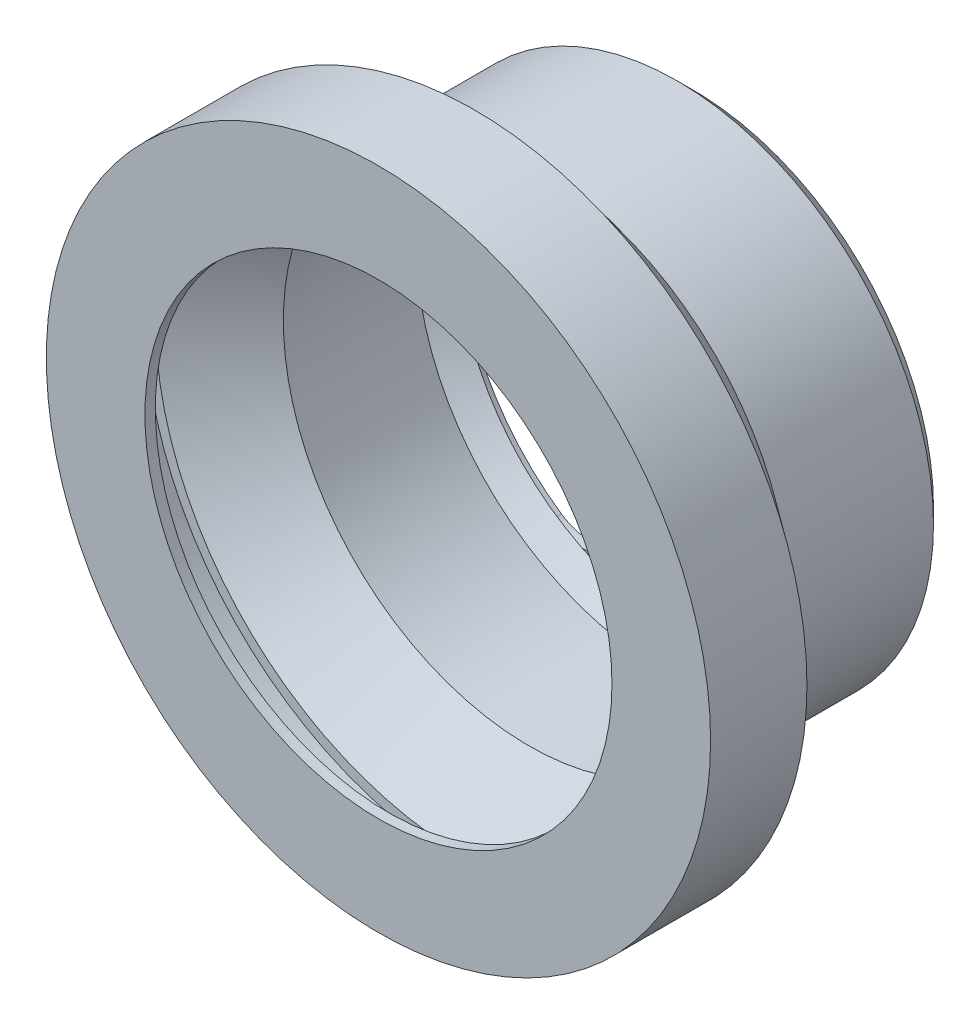
from build123d import *

# Parameters (mm, degrees)
BOSS_EXTRUDE2_START = 2
SKETCH3_R           = 49.35
SKETCH3_R_2         = 1.5
BOSS_EXTRUDE2_DEPTH = 2
FILLET1_R           = 10
FILLET2_R           = 10
CHAMFER1_SIZE       = 3
SKETCH6_W           = 130.40409261
SKETCH6_H           = 9
CUT_EXTRUDE1_DEPTH  = 72
SKETCH7_R           = 64
SKETCH7_R_2         = 45
BOSS_EXTRUDE3_DEPTH = 2


with BuildPart() as part:
    # Sketch2 → Revolve1 (revolve)
    with BuildSketch(Plane(origin=(0, 0, 0), x_dir=(0, 0, -1), z_dir=(1, 0, 0)), mode=Mode.PRIVATE) as revolve1_sk:
        Polygon((65.6, 47.35), (37, 47.35), (36.023809561, 47.35), (24, 60), (24, 62), (0, 62), (0, 64), (25.567979838, 64), (37, 49.35), (65.6, 49.35), align=None)
    revolve(revolve1_sk.sketch.rotate(Axis((0, 0, 1), (0, 0, -1)), 90), axis=Axis((0, 0, 1), (0, 0, -1)))

    # Sketch3 → Boss-Extrude2 (add)
    with BuildSketch(Plane(origin=(0, 0, -65.6), x_dir=(-1, 0, 0), z_dir=(0, 0, -1)).offset(BOSS_EXTRUDE2_START)):
        with Locations(Location((0, 0, 0), (0, 0, 180))):
            Circle(SKETCH3_R)
        with Locations((-14.646406867, -3.237709975)):
            Circle(SKETCH3_R_2, mode=Mode.SUBTRACT)
        with Locations((-3.237709975, 14.646406867)):
            Circle(SKETCH3_R_2, mode=Mode.SUBTRACT)
        with Locations((3.237709975, -14.646406867)):
            Circle(SKETCH3_R_2, mode=Mode.SUBTRACT)
        with Locations((14.646406867, 3.237709975)):
            Circle(SKETCH3_R_2, mode=Mode.SUBTRACT)
        with BuildLine():
            Line((2.426668662, -24.876217196), (6.743615296, -44.404759685))
            ThreePointArc((6.743615296, -44.404759685), (-24.155488069, -37.865174318), (-43.109904177, -12.601527718))
            Line((-43.109904177, -12.601527718), (-23.581361687, -8.284581085))
            ThreePointArc((-23.581361687, -8.284581085), (-13.442501867, -21.071640807), (2.426668662, -24.876217196))
        make_face(mode=Mode.SUBTRACT)
        with BuildLine():
            Line((-24.876217196, -2.426668662), (-44.404759685, -6.743615296))
            ThreePointArc((-44.404759685, -6.743615296), (-37.865174318, 24.155488069), (-12.601527718, 43.109904177))
            Line((-12.601527718, 43.109904177), (-8.284581085, 23.581361687))
            ThreePointArc((-8.284581085, 23.581361687), (-21.071640807, 13.442501867), (-24.876217196, -2.426668662))
        make_face(mode=Mode.SUBTRACT)
        with BuildLine():
            Line((-2.426668662, 24.876217196), (-6.743615296, 44.404759685))
            ThreePointArc((-6.743615296, 44.404759685), (24.155488069, 37.865174318), (43.109904177, 12.601527718))
            Line((43.109904177, 12.601527718), (23.581361687, 8.284581085))
            ThreePointArc((23.581361687, 8.284581085), (13.442501867, 21.071640807), (-2.426668662, 24.876217196))
        make_face(mode=Mode.SUBTRACT)
        with BuildLine():
            Line((8.284581085, -23.581361687), (12.601527718, -43.109904177))
            ThreePointArc((12.601527718, -43.109904177), (37.865174318, -24.155488069), (44.404759685, 6.743615296))
            Line((44.404759685, 6.743615296), (24.876217196, 2.426668662))
            ThreePointArc((24.876217196, 2.426668662), (21.071640807, -13.442501867), (8.284581085, -23.581361687))
        make_face(mode=Mode.SUBTRACT)
    extrude(amount=-BOSS_EXTRUDE2_DEPTH)

    # Fillet1
    # the kernel refuses this fillet: 10 mm, written as the material it adds along each edge
    with BuildSketch(Plane(origin=(-12.601527718, -43.109904177, -67.6), x_dir=(-0.9040126559830293, 0.4275056933217488, 0), z_dir=(0, 0, 1))) as fillet1_piece_1:
        with BuildLine():
            CenterArc((12.508516939, -9.876472905), FILLET1_R, 80.98497739, 111.859148491)
            Line((2.758732525, -12.099467257), (0, 0))
            ThreePointArc((0, 0), (7.037725598, 0.554809366), (14.075451195, 0))
        make_face()
    extrude(amount=2)
    with BuildSketch(Plane(origin=(-8.284581085, -23.581361687, -67.6), x_dir=(-0.8924722154511289, 0.45110236604096154, 0), z_dir=(0, 0, 1))) as fillet1_piece_2:
        with BuildLine():
            CenterArc((7.785535121, 9.915423441), FILLET1_R, 194.349189504, 68.193723572)
            Line((-1.902498089, 7.437115043), (0, 0))
            ThreePointArc((0, 0), (3.243849617, 0.211393168), (6.487699233, 0))
        make_face()
    extrude(amount=2)
    with BuildSketch(Plane(origin=(-24.876217196, 2.426668662, -67.6), x_dir=(-0.9764271244734938, 0.21584733167779538, 0), z_dir=(0, 0, 1))) as fillet1_piece_3:
        with BuildLine():
            CenterArc((7.676408375, 10), FILLET1_R, 201.807483199, 68.192516801)
            ThreePointArc((-1.607964784, 6.285109014), (-0.599195502, 3.194946614), (0, 0))
            Line((0, 0), (7.676408375, 0))
        make_face()
    extrude(amount=2)
    with BuildSketch(Plane(origin=(-44.404759685, 6.743615296, -67.6), x_dir=(0.006629845184633897, -0.999978022334905, 0), z_dir=(0, 0, 1))) as fillet1_piece_4:
        with BuildLine():
            CenterArc((12.508734152, 9.876468588), FILLET1_R, 167.15489194, 111.860288522)
            Line((2.758987847, 12.099630073), (0, 0))
            ThreePointArc((0, 0), (7.037847809, -0.554828755), (14.075695618, 0))
        make_face()
    extrude(amount=2)

    # Fillet2
    # the kernel refuses this fillet: 10 mm, written as the material it adds along each edge
    with BuildSketch(Plane(origin=(-43.109904177, 12.601527718, -67.6), x_dir=(0.4275056933217496, 0.9040126559830289, 0), z_dir=(0, 0, 1))) as fillet2_piece_1:
        with BuildLine():
            CenterArc((12.508516939, -9.876472905), FILLET2_R, 80.98497739, 111.859148491)
            Line((2.758732525, -12.099467257), (0, 0))
            ThreePointArc((0, 0), (7.037725598, 0.554809366), (14.075451195, 0))
        make_face()
    extrude(amount=2)
    with BuildSketch(Plane(origin=(-23.581361687, 8.284581085, -67.6), x_dir=(-0.9764271244734907, 0.21584733167780967, 0), z_dir=(0, 0, 1)), Plane(origin=(8.284581085, 23.581361687, -67.6), x_dir=(0.21584733167780917, 0.9764271244734908, 0), z_dir=(0, 0, 1)), Plane(origin=(23.581361687, -8.284581085, -67.6), x_dir=(0.9764271244734907, -0.21584733167780934, 0), z_dir=(0, 0, 1))) as fillet2_piece_2:
        with BuildLine():
            CenterArc((7.676599451, -10), FILLET2_R, 90, 68.193723572)
            ThreePointArc((-1.607851949, -6.285304563), (-0.599127572, -3.195042028), (0, 0))
            Line((0, 0), (7.676599451, 0))
        make_face()
    extrude(amount=2)
    with BuildSketch(Plane(origin=(2.426668662, 24.876217196, -67.6), x_dir=(0.2158473316777956, 0.9764271244734938, 0), z_dir=(0, 0, 1))) as fillet2_piece_3:
        with BuildLine():
            CenterArc((7.676408375, 10), FILLET2_R, 201.807483199, 68.192516801)
            ThreePointArc((-1.607964784, 6.285109014), (-0.599195502, 3.194946614), (0, 0))
            Line((0, 0), (7.676408375, 0))
        make_face()
    extrude(amount=2)
    with BuildSketch(Plane(origin=(6.743615296, 44.404759685, -67.6), x_dir=(-0.999978022334905, -0.006629845184635393, 0), z_dir=(0, 0, 1)), Plane(origin=(44.404759685, -6.743615296, -67.6), x_dir=(-0.006629845184635893, 0.999978022334905, 0), z_dir=(0, 0, 1)), Plane(origin=(-6.743615296, -44.404759685, -67.6), x_dir=(0.999978022334905, 0.00662984518463539, 0), z_dir=(0, 0, 1))) as fillet2_piece_4:
        with BuildLine():
            CenterArc((12.508734152, 9.876468588), FILLET2_R, 167.15489194, 111.860288522)
            Line((2.758987847, 12.099630073), (0, 0))
            ThreePointArc((0, 0), (7.037847809, -0.554828755), (14.075695618, 0))
        make_face()
    extrude(amount=2)
    with BuildSketch(Plane(origin=(24.876217196, -2.426668662, -67.6), x_dir=(-0.032899449429987265, 0.9994586665926729, 0), z_dir=(0, 0, 1)), Plane(origin=(-2.426668662, -24.876217196, -67.6), x_dir=(0.9994586665926729, 0.03289944942998876, 0), z_dir=(0, 0, 1))) as fillet2_piece_5:
        with BuildLine():
            CenterArc((7.785341334, -9.915427669), FILLET2_R, 97.456900257, 68.192516801)
            Line((-1.902631601, -7.436883658), (0, 0))
            ThreePointArc((0, 0), (3.243768875, -0.2113826), (6.48753775, 0))
        make_face()
    extrude(amount=2)
    with BuildSketch(Plane(origin=(12.601527718, 43.109904177, -67.6), x_dir=(-0.21584733167780898, -0.9764271244734908, 0), z_dir=(0, 0, 1)), Plane(origin=(43.109904177, -12.601527718, -67.6), x_dir=(-0.9764271244734909, 0.21584733167780892, 0), z_dir=(0, 0, 1))) as fillet2_piece_6:
        with BuildLine():
            CenterArc((12.40998441, 10), FILLET2_R, 158.140851509, 111.859148491)
            ThreePointArc((3.128964851, 13.723261468), (1.023555255, 6.984964542), (0, 0))
            Line((0, 0), (12.40998441, 0))
        make_face()
    extrude(amount=2)

    # Sketch5 → Revolve2 (revolve)
    with BuildSketch(Plane(origin=(0, 0, 0), x_dir=(1, 0, 0), z_dir=(0, 1, 0)), mode=Mode.PRIVATE) as revolve2_sk:
        Polygon((-47.35, 61.6), (-43.35, 65.6), (-47.35, 65.6), align=None)
    revolve(revolve2_sk.sketch.rotate(Axis((0, 0, 0), (0, 0, -1)), 180), axis=Axis((0, 0, 0), (0, 0, -1)))

    # Chamfer1
    chamfer1_edges = [part.edges().sort_by_distance(p)[0] for p in [
        (-49.35, 0, -67.6),
    ]]
    chamfer(chamfer1_edges, length=CHAMFER1_SIZE)

    # Sketch6 → Cut-Extrude1 (cut, symmetric)
    with BuildSketch(Plane(origin=(0, 0, 0), x_dir=(1, 0, 0), z_dir=(0, 1, 0))):
        with Locations((-1.202046305, 4.5)):
            Rectangle(SKETCH6_W, SKETCH6_H)
    extrude(amount=CUT_EXTRUDE1_DEPTH, both=True, mode=Mode.SUBTRACT)

    # Sketch7 → Boss-Extrude3 (add)
    with BuildSketch(Plane.XY.offset(-9)):
        Circle(SKETCH7_R)
        Circle(SKETCH7_R_2, mode=Mode.SUBTRACT)
    extrude(amount=BOSS_EXTRUDE3_DEPTH)


solid = part.part
